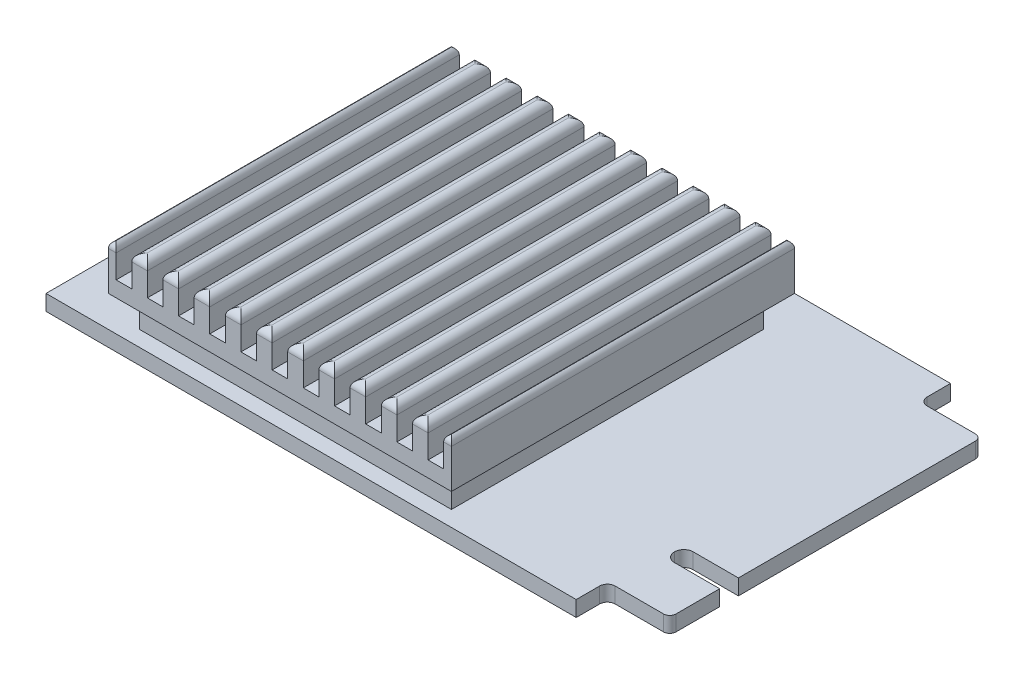
from build123d import *

# Parameters (mm, degrees)
SKETCH_1_W          = 34
SKETCH_1_H          = 24
EXTRUDE_1_DEPTH     = 1
SKETCH_2_W          = 4
SKETCH_2_H          = 20
EXTRUDE_2_DEPTH     = 1
SKETCH_3_W          = 3.5
SKETCH_3_H          = 1.2
CUT_EXTRUDE_1_DEPTH = 25.207436874
FILLET_1_R          = 0.6
FILLET_2_R          = 0.5
FILLET_3_R          = 0.4
SKETCH_4_R          = 1.5
CUT_EXTRUDE_2_DEPTH = 25.207436874
SKETCH_8_W          = 20
SKETCH_8_H          = 20
EXTRUDE_9_DEPTH     = 2
SKETCH_5_W          = 22
SKETCH_5_H          = 22
EXTRUDE_3_DEPTH     = 3
SKETCH_6_W          = 1
SKETCH_6_H          = 22
CUT_EXTRUDE_3_DEPTH = 2
FILLET_4_R          = 0.5


# Some blends are built 0.0001 mm under size
with BuildPart() as part:
    # 草图1 → 凸台-拉伸1 (new body)
    with BuildSketch(Plane(origin=(0, 0, 0), x_dir=(1, 0, 0), z_dir=(0, 1, 0))):
        Rectangle(SKETCH_1_W, SKETCH_1_H)
    extrude(amount=EXTRUDE_1_DEPTH)

    # 草图2 → 凸台-拉伸2 (add)
    with BuildSketch(Plane(origin=(0, 0, 0), x_dir=(1, 0, 0), z_dir=(0, 1, 0))):
        with Locations((19, 0)):
            Rectangle(SKETCH_2_W, SKETCH_2_H)
    extrude(amount=EXTRUDE_2_DEPTH)

    # 草图3 → 切除-拉伸1 (cut, through all)
    with BuildSketch(Plane(origin=(0, 1, 0), x_dir=(1, 0, 0), z_dir=(0, 1, 0))):
        with Locations((19.25, -6.2)):
            Rectangle(SKETCH_3_W, SKETCH_3_H)
    extrude(amount=-CUT_EXTRUDE_1_DEPTH, mode=Mode.SUBTRACT)

    # 圆角1
    fillet_1_edges = [part.edges().sort_by_distance(p)[0] for p in [
        (17.5, 0.5, 6.8),
        (17.5, 0.5, 5.6),
    ]]
    fillet(fillet_1_edges, radius=FILLET_1_R - 0.0001)  # a hair under: the kernel refuses the full size

    # 圆角2
    fillet_2_edges = [part.edges().sort_by_distance(p)[0] for p in [
        (17, 0.5, -10),
        (17, 0.5, 10),
    ]]
    fillet(fillet_2_edges, radius=FILLET_2_R)

    # 圆角3
    fillet_3_edges = [part.edges().sort_by_distance(p)[0] for p in [
        (21, 0.5, 10),
        (21, 0.5, -10),
    ]]
    fillet(fillet_3_edges, radius=FILLET_3_R)

    # 草图4 → 切除-拉伸2 (cut, through all)
    with BuildSketch(Plane(origin=(0, 1, 0), x_dir=(1, 0, 0), z_dir=(0, 1, 0))):
        with Locations((-17, 7)):
            Circle(SKETCH_4_R)
    extrude(amount=-CUT_EXTRUDE_2_DEPTH, mode=Mode.SUBTRACT)

    # 草图8 → 凸台-拉伸9 (add)
    with BuildSketch(Plane(origin=(0, 1, 0), x_dir=(1, 0, 0), z_dir=(0, 1, 0))):
        with Locations((-2, -1)):
            Rectangle(SKETCH_8_W, SKETCH_8_H)
    extrude(amount=EXTRUDE_9_DEPTH)

    # 草图5 → 凸台-拉伸3 (add)
    with BuildSketch(Plane(origin=(0, 3, 0), x_dir=(1, 0, 0), z_dir=(0, 1, 0))):
        with Locations((-2, -1)):
            Rectangle(SKETCH_5_W, SKETCH_5_H)
    extrude(amount=EXTRUDE_3_DEPTH)

    # 草图6 → 切除-拉伸3 (cut)
    with BuildSketch(Plane(origin=(0, 6, 0), x_dir=(1, 0, 0), z_dir=(0, 1, 0))):
        with Locations((-2, -1)):
            Rectangle(SKETCH_6_W, SKETCH_6_H)
        with Locations((0, -1)):
            Rectangle(SKETCH_6_W, SKETCH_6_H)
        with Locations((2, -1)):
            Rectangle(SKETCH_6_W, SKETCH_6_H)
        with Locations((4, -1)):
            Rectangle(SKETCH_6_W, SKETCH_6_H)
        with Locations((6, -1)):
            Rectangle(SKETCH_6_W, SKETCH_6_H)
        with Locations((8, -1)):
            Rectangle(SKETCH_6_W, SKETCH_6_H)
        with Locations((-4, -1)):
            Rectangle(SKETCH_6_W, SKETCH_6_H)
        with Locations((-6, -1)):
            Rectangle(SKETCH_6_W, SKETCH_6_H)
        with Locations((-8, -1)):
            Rectangle(SKETCH_6_W, SKETCH_6_H)
        with Locations((-10, -1)):
            Rectangle(SKETCH_6_W, SKETCH_6_H)
        with Locations((-12, -1)):
            Rectangle(SKETCH_6_W, SKETCH_6_H)
    extrude(amount=-CUT_EXTRUDE_3_DEPTH, mode=Mode.SUBTRACT)

    # 圆角4
    # the kernel refuses this fillet: 0.5 mm, written as the material it takes off along each edge
    with BuildSketch(Plane(origin=(-13, 6, 13.25), x_dir=(0, -1, 0), z_dir=(0, 0, -1)), Plane(origin=(-11.5, 6, 13.25), x_dir=(0, -1, 0), z_dir=(0, 0, -1)), Plane(origin=(-9.5, 6, 13.25), x_dir=(0, -1, 0), z_dir=(0, 0, -1)), Plane(origin=(0.5, 6, 13.25), x_dir=(0, -1, 0), z_dir=(0, 0, -1)), Plane(origin=(2.5, 6, 13.25), x_dir=(0, -1, 0), z_dir=(0, 0, -1)), Plane(origin=(4.5, 6, 13.25), x_dir=(0, -1, 0), z_dir=(0, 0, -1)), Plane(origin=(6.5, 6, 13.25), x_dir=(0, -1, 0), z_dir=(0, 0, -1)), Plane(origin=(8.5, 6, 13.25), x_dir=(0, -1, 0), z_dir=(0, 0, -1)), Plane(origin=(-3.5, 6, 13.25), x_dir=(0, -1, 0), z_dir=(0, 0, -1)), Plane(origin=(-5.5, 6, 13.25), x_dir=(0, -1, 0), z_dir=(0, 0, -1)), Plane(origin=(-7.5, 6, 13.25), x_dir=(0, -1, 0), z_dir=(0, 0, -1)), Plane(origin=(-2.5, 6, 13.25), x_dir=(-1, 0, 0), z_dir=(0, 0, -1))) as fillet_4_piece_1:
        with BuildLine():
            CenterArc((FILLET_4_R, -FILLET_4_R), FILLET_4_R, 90, 90)
            Line((0, -FILLET_4_R), (0, 0))
            Line((0, 0), (FILLET_4_R, 0))
        make_face()
    extrude(amount=24.5, mode=Mode.SUBTRACT)
    with BuildSketch(Plane(origin=(-11.25, 6, 12), x_dir=(0, -1, 0), z_dir=(-1, 0, 0)), Plane(origin=(10.25, 6, 12), x_dir=(0, -1, 0), z_dir=(-1, 0, 0))) as fillet_4_piece_2:
        with BuildLine():
            CenterArc((FILLET_4_R, -FILLET_4_R), FILLET_4_R, 90, 90)
            Line((0, -FILLET_4_R), (0, 0))
            Line((0, 0), (FILLET_4_R, 0))
        make_face()
    extrude(amount=3, mode=Mode.SUBTRACT)
    with BuildSketch(Plane(origin=(9, 6, -11.25), x_dir=(-1, 0, 0), z_dir=(0, 0, 1)), Plane(origin=(-12.5, 6, -11.25), x_dir=(-1, 0, 0), z_dir=(0, 0, 1)), Plane(origin=(-10.5, 6, -11.25), x_dir=(-1, 0, 0), z_dir=(0, 0, 1)), Plane(origin=(-0.5, 6, -11.25), x_dir=(-1, 0, 0), z_dir=(0, 0, 1)), Plane(origin=(1.5, 6, -11.25), x_dir=(-1, 0, 0), z_dir=(0, 0, 1)), Plane(origin=(3.5, 6, -11.25), x_dir=(-1, 0, 0), z_dir=(0, 0, 1)), Plane(origin=(5.5, 6, -11.25), x_dir=(-1, 0, 0), z_dir=(0, 0, 1)), Plane(origin=(7.5, 6, -11.25), x_dir=(-1, 0, 0), z_dir=(0, 0, 1)), Plane(origin=(-4.5, 6, -11.25), x_dir=(-1, 0, 0), z_dir=(0, 0, 1)), Plane(origin=(-6.5, 6, -11.25), x_dir=(-1, 0, 0), z_dir=(0, 0, 1)), Plane(origin=(-8.5, 6, -11.25), x_dir=(-1, 0, 0), z_dir=(0, 0, 1)), Plane(origin=(-1.5, 6, -11.25), x_dir=(0, -1, 0), z_dir=(0, 0, 1))) as fillet_4_piece_3:
        with BuildLine():
            CenterArc((FILLET_4_R, FILLET_4_R), FILLET_4_R, 180, 90)
            Line((0, FILLET_4_R), (0, 0))
            Line((0, 0), (FILLET_4_R, 0))
        make_face()
    extrude(amount=24.5, mode=Mode.SUBTRACT)
    with BuildSketch(Plane(origin=(7.25, 6, -10), x_dir=(0, 0, 1), z_dir=(1, 0, 0)), Plane(origin=(-14.25, 6, -10), x_dir=(0, 0, 1), z_dir=(1, 0, 0))) as fillet_4_piece_4:
        with BuildLine():
            CenterArc((FILLET_4_R, FILLET_4_R), FILLET_4_R, 180, 90)
            Line((0, FILLET_4_R), (0, 0))
            Line((0, 0), (FILLET_4_R, 0))
        make_face()
    extrude(amount=3, mode=Mode.SUBTRACT)
    with BuildSketch(Plane(origin=(-9.25, 6, 12), x_dir=(0, -1, 0), z_dir=(-1, 0, 0)), Plane(origin=(-7.25, 6, 12), x_dir=(0, -1, 0), z_dir=(-1, 0, 0)), Plane(origin=(-5.25, 6, 12), x_dir=(0, -1, 0), z_dir=(-1, 0, 0)), Plane(origin=(-3.25, 6, 12), x_dir=(0, -1, 0), z_dir=(-1, 0, 0)), Plane(origin=(-1.25, 6, 12), x_dir=(0, -1, 0), z_dir=(-1, 0, 0)), Plane(origin=(0.75, 6, 12), x_dir=(0, -1, 0), z_dir=(-1, 0, 0)), Plane(origin=(2.75, 6, 12), x_dir=(0, -1, 0), z_dir=(-1, 0, 0)), Plane(origin=(4.75, 6, 12), x_dir=(0, -1, 0), z_dir=(-1, 0, 0)), Plane(origin=(6.75, 6, 12), x_dir=(0, -1, 0), z_dir=(-1, 0, 0)), Plane(origin=(8.75, 6, 12), x_dir=(0, -1, 0), z_dir=(-1, 0, 0))) as fillet_4_piece_5:
        with BuildLine():
            CenterArc((FILLET_4_R, -FILLET_4_R), FILLET_4_R, 90, 90)
            Line((0, -FILLET_4_R), (0, 0))
            Line((0, 0), (FILLET_4_R, 0))
        make_face()
    extrude(amount=3.5, mode=Mode.SUBTRACT)
    with BuildSketch(Plane(origin=(5.25, 6, -10), x_dir=(0, 0, 1), z_dir=(1, 0, 0)), Plane(origin=(3.25, 6, -10), x_dir=(0, 0, 1), z_dir=(1, 0, 0)), Plane(origin=(1.25, 6, -10), x_dir=(0, 0, 1), z_dir=(1, 0, 0)), Plane(origin=(-0.75, 6, -10), x_dir=(0, 0, 1), z_dir=(1, 0, 0)), Plane(origin=(-2.75, 6, -10), x_dir=(0, 0, 1), z_dir=(1, 0, 0)), Plane(origin=(-4.75, 6, -10), x_dir=(0, 0, 1), z_dir=(1, 0, 0)), Plane(origin=(-6.75, 6, -10), x_dir=(0, 0, 1), z_dir=(1, 0, 0)), Plane(origin=(-8.75, 6, -10), x_dir=(0, 0, 1), z_dir=(1, 0, 0)), Plane(origin=(-10.75, 6, -10), x_dir=(0, 0, 1), z_dir=(1, 0, 0)), Plane(origin=(-12.75, 6, -10), x_dir=(0, 0, 1), z_dir=(1, 0, 0))) as fillet_4_piece_6:
        with BuildLine():
            CenterArc((FILLET_4_R, FILLET_4_R), FILLET_4_R, 180, 90)
            Line((0, FILLET_4_R), (0, 0))
            Line((0, 0), (FILLET_4_R, 0))
        make_face()
    extrude(amount=3.5, mode=Mode.SUBTRACT)


solid = part.part
